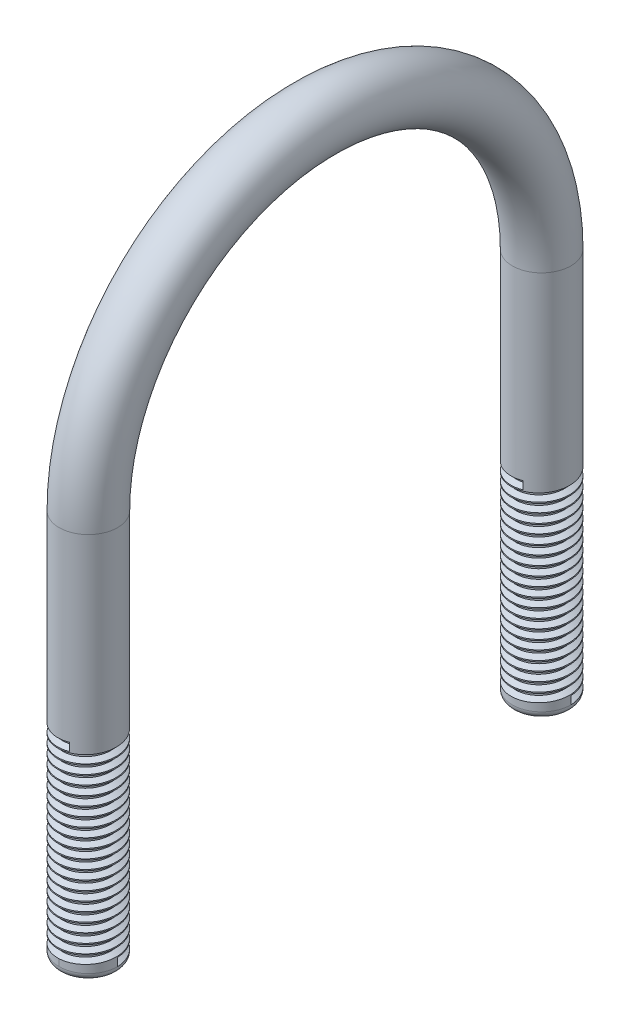
from build123d import *

# Parameters (mm, degrees)
SKETCH_2_R     = 4
FILLET_1_R     = 1
THREAD_1_PITCH = 1.25
THREAD_2_PITCH = 1.25


with BuildPart() as part:
    # По траектории1: sweep along a path in Sketch 1
    with BuildLine(Plane(origin=(0, 0, 0), x_dir=(0, 0, -1), z_dir=(1, 0, 0))) as sweep_1_path:
        Line((-31, 0), (-31, 53))
        ThreePointArc((-31, 53), (0, 84), (31, 53))
        Line((31, 53), (31, 0))
    # Sketch 2 → По траектории1 (sweep)
    with BuildSketch(Plane(origin=(0, 0, 0), x_dir=(1, 0, 0), z_dir=(0, 1, 0))):
        with Locations((0, 31)):
            Circle(SKETCH_2_R)
    sweep(path=sweep_1_path.line)

    # Скругление1
    fillet_1_edges = [part.edges().sort_by_distance(p)[0] for p in [
        (-4, 0, -31),
        (-4, 0, 31),
    ]]
    fillet(fillet_1_edges, radius=FILLET_1_R)

    # Резьба1: the profile of Sketch 1 2 profile screwed along a right-hand helix of 20.8 turns, 8 arcs to a turn; built about Z, then put on its axis
    thread_1_z = Axis((0, 0, 0), (0, 0, 1))
    thread_1_corners = [(4.0003, 0, -0.000173205), (4.0003, 0, 1.093923202), (3.323417656, 0, 0.703124998), (3.323417656, 0, 0.390624998)]
    with BuildLine(mode=Mode.PRIVATE) as thread_1_profile:
        Line(thread_1_corners[0], thread_1_corners[1])
        Line(thread_1_corners[1], thread_1_corners[2])
        Line(thread_1_corners[2], thread_1_corners[3])
        Line(thread_1_corners[3], thread_1_corners[0])
    thread_1_cap = Face(thread_1_profile.wire())
    thread_1_turn_angles = [0, 22.5, 45, 67.5, 90, 112.5, 135, 157.5, 180, 202.5, 225, 247.5, 270, 292.5, 315, 337.5, 360]
    thread_1_turn_weights = [1, 0.9238795325112867, 1, 0.9238795325112867, 1, 0.9238795325112867, 1, 0.9238795325112867, 1, 0.9238795325112867, 1, 0.9238795325112867, 1, 0.9238795325112867, 1, 0.9238795325112867, 1]
    thread_1_turn_rails = [Edge.make_bspline([Vector(p[0], p[1], 0).rotate(thread_1_z, thread_1_turn_angles[k]) / thread_1_turn_weights[k] + Vector(0, 0, p[2] + THREAD_1_PITCH * thread_1_turn_angles[k] / 360) for k in range(17)], [0, 0, 0, 1, 1, 2, 2, 3, 3, 4, 4, 5, 5, 6, 6, 7, 7, 8, 8, 8], 2, thread_1_turn_weights) for p in thread_1_corners]
    thread_1_turn_sides = [Face.make_surface_from_curves(thread_1_turn_rails[p[0]], thread_1_turn_rails[p[1]]) for p in [(0, 1), (1, 2), (2, 3), (3, 0)]]
    thread_1_last_angles = [7200, 7222.5, 7245, 7267.5, 7290, 7312.5, 7335, 7357.5, 7380, 7402.5, 7425, 7447.5, 7470, 7479, 7488]
    thread_1_last_weights = [1, 0.9238795325112867, 1, 0.9238795325112867, 1, 0.9238795325112867, 1, 0.9238795325112867, 1, 0.9238795325112867, 1, 0.9238795325112867, 1, 0.9876883405951378, 1]
    thread_1_last_rails = [Edge.make_bspline([Vector(p[0], p[1], 0).rotate(thread_1_z, thread_1_last_angles[k]) / thread_1_last_weights[k] + Vector(0, 0, p[2] + THREAD_1_PITCH * thread_1_last_angles[k] / 360) for k in range(15)], [0, 0, 0, 1, 1, 2, 2, 3, 3, 4, 4, 5, 5, 6, 6, 7, 7, 7], 2, thread_1_last_weights) for p in thread_1_corners]
    thread_1_last_sides = [Face.make_surface_from_curves(thread_1_last_rails[p[0]], thread_1_last_rails[p[1]]) for p in [(0, 1), (1, 2), (2, 3), (3, 0)]]
    thread_1 = Plane(origin=(0, 1, 31), x_dir=(1, 0, 0), z_dir=(0, 1, 0)) * Solid(Shell([*[p.moved(Location((0, 0, THREAD_1_PITCH * i))) for i in range(20) for p in thread_1_turn_sides], *thread_1_last_sides, thread_1_cap, thread_1_cap.rotate(thread_1_z, 7488).moved(Location((0, 0, THREAD_1_PITCH * 7488 / 360)))]))
    add(thread_1, mode=Mode.SUBTRACT)

    # Резьба2: the profile of Sketch 2 2 profile screwed along a right-hand helix of 20.8 turns, 8 arcs to a turn; built about Z, then put on its axis
    thread_2_z = Axis((0, 0, 0), (0, 0, 1))
    thread_2_corners = [(4.0003, 0, -0.000173205), (4.0003, 0, 1.093923202), (3.323417656, 0, 0.703124998), (3.323417656, 0, 0.390624998)]
    with BuildLine(mode=Mode.PRIVATE) as thread_2_profile:
        Line(thread_2_corners[0], thread_2_corners[1])
        Line(thread_2_corners[1], thread_2_corners[2])
        Line(thread_2_corners[2], thread_2_corners[3])
        Line(thread_2_corners[3], thread_2_corners[0])
    thread_2_cap = Face(thread_2_profile.wire())
    thread_2_turn_angles = [0, 22.5, 45, 67.5, 90, 112.5, 135, 157.5, 180, 202.5, 225, 247.5, 270, 292.5, 315, 337.5, 360]
    thread_2_turn_weights = [1, 0.9238795325112867, 1, 0.9238795325112867, 1, 0.9238795325112867, 1, 0.9238795325112867, 1, 0.9238795325112867, 1, 0.9238795325112867, 1, 0.9238795325112867, 1, 0.9238795325112867, 1]
    thread_2_turn_rails = [Edge.make_bspline([Vector(p[0], p[1], 0).rotate(thread_2_z, thread_2_turn_angles[k]) / thread_2_turn_weights[k] + Vector(0, 0, p[2] + THREAD_2_PITCH * thread_2_turn_angles[k] / 360) for k in range(17)], [0, 0, 0, 1, 1, 2, 2, 3, 3, 4, 4, 5, 5, 6, 6, 7, 7, 8, 8, 8], 2, thread_2_turn_weights) for p in thread_2_corners]
    thread_2_turn_sides = [Face.make_surface_from_curves(thread_2_turn_rails[p[0]], thread_2_turn_rails[p[1]]) for p in [(0, 1), (1, 2), (2, 3), (3, 0)]]
    thread_2_last_angles = [7200, 7222.5, 7245, 7267.5, 7290, 7312.5, 7335, 7357.5, 7380, 7402.5, 7425, 7447.5, 7470, 7479, 7488]
    thread_2_last_weights = [1, 0.9238795325112867, 1, 0.9238795325112867, 1, 0.9238795325112867, 1, 0.9238795325112867, 1, 0.9238795325112867, 1, 0.9238795325112867, 1, 0.9876883405951378, 1]
    thread_2_last_rails = [Edge.make_bspline([Vector(p[0], p[1], 0).rotate(thread_2_z, thread_2_last_angles[k]) / thread_2_last_weights[k] + Vector(0, 0, p[2] + THREAD_2_PITCH * thread_2_last_angles[k] / 360) for k in range(15)], [0, 0, 0, 1, 1, 2, 2, 3, 3, 4, 4, 5, 5, 6, 6, 7, 7, 7], 2, thread_2_last_weights) for p in thread_2_corners]
    thread_2_last_sides = [Face.make_surface_from_curves(thread_2_last_rails[p[0]], thread_2_last_rails[p[1]]) for p in [(0, 1), (1, 2), (2, 3), (3, 0)]]
    thread_2 = Plane(origin=(0, 1, -31), x_dir=(1, 0, 0), z_dir=(0, 1, 0)) * Solid(Shell([*[p.moved(Location((0, 0, THREAD_2_PITCH * i))) for i in range(20) for p in thread_2_turn_sides], *thread_2_last_sides, thread_2_cap, thread_2_cap.rotate(thread_2_z, 7488).moved(Location((0, 0, THREAD_2_PITCH * 7488 / 360)))]))
    add(thread_2, mode=Mode.SUBTRACT)


solid = part.part
